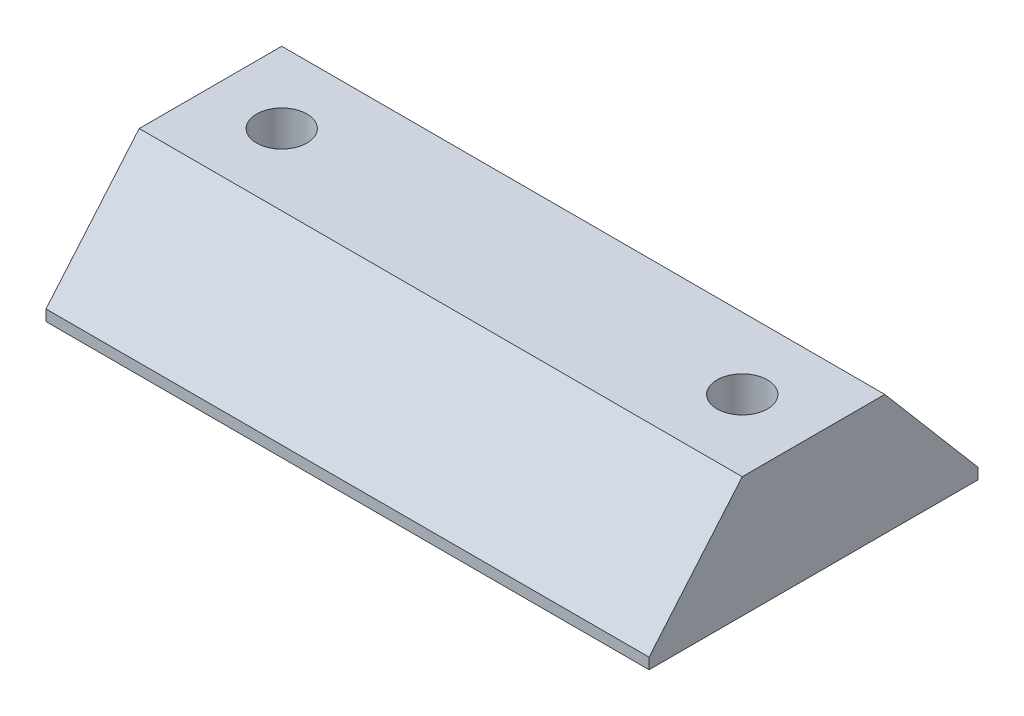
from build123d import *
from OCP.BRepFilletAPI import BRepFilletAPI_MakeChamfer

# Parameters (mm, degrees)
SKETCH2_W           = 55
SKETCH2_H           = 30
BOSS_EXTRUDE1_DEPTH = 11
CHAMFER1_SIZE       = 10
CHAMFER1_SIZE2      = 8.5
CUT_EXTRUDE1_REACH  = 65.608
SKETCH3_R           = 2.3
SKETCH4_W           = 22
SKETCH4_H           = 7.8
BOSS_EXTRUDE2_DEPTH = 3


with BuildPart() as part:
    # Sketch2 → Boss-Extrude1 (new body)
    with BuildSketch(Plane(origin=(0, 0, 0), x_dir=(1, 0, 0), z_dir=(0, 1, 0))):
        with Locations((27.5, 15)):
            Rectangle(SKETCH2_W, SKETCH2_H)
    extrude(amount=BOSS_EXTRUDE1_DEPTH)

    # Chamfer1: one chamfer whose edges measure the first distance from different faces: ONE call of the kernel's chamfer builder (chamfer() names one face for all edges)
    chamfer1_edges_1 = [part.edges().sort_by_distance(p)[0] for p in [
        (27.5, 11, -30),
    ]]
    chamfer1_side_1 = [part.faces().sort_by_distance(p)[0] for p in [
        (27.5, 5.5, -30),
    ]]
    chamfer1_edges_2 = [part.edges().sort_by_distance(p)[0] for p in [
        (27.5, 11, 0),
    ]]
    chamfer1_side_2 = [part.faces().sort_by_distance(p)[0] for p in [
        (27.5, 5.5, 0),
    ]]
    chamfer1 = BRepFilletAPI_MakeChamfer(part.part.solid().wrapped)
    for e in chamfer1_edges_1:
        chamfer1.Add(CHAMFER1_SIZE, CHAMFER1_SIZE2, e.wrapped, chamfer1_side_1[0].wrapped)  # the first distance lies on this face
    for e in chamfer1_edges_2:
        chamfer1.Add(CHAMFER1_SIZE, CHAMFER1_SIZE2, e.wrapped, chamfer1_side_2[0].wrapped)  # the first distance lies on this face
    add(Compound.cast(chamfer1.Shape()), mode=Mode.REPLACE)

    # Sketch3 → Cut-Extrude1 (cut, up to next)
    with BuildSketch(Plane(origin=(0, 11, 0), x_dir=(1, 0, 0), z_dir=(0, 1, 0)), mode=Mode.PRIVATE) as cut_extrude1_sk1:
        with Locations((6.5, 15)):
            Circle(SKETCH3_R)
    cut_extrude1_tool1 = extrude(cut_extrude1_sk1.sketch, amount=-CUT_EXTRUDE1_REACH, mode=Mode.PRIVATE) & part.part
    # Sketch3 → Cut-Extrude1 (cut, up to next)
    with BuildSketch(Plane(origin=(0, 11, 0), x_dir=(1, 0, 0), z_dir=(0, 1, 0)), mode=Mode.PRIVATE) as cut_extrude1_sk2:
        with Locations((48.5, 15)):
            Circle(SKETCH3_R)
    cut_extrude1_tool2 = extrude(cut_extrude1_sk2.sketch, amount=-CUT_EXTRUDE1_REACH, mode=Mode.PRIVATE) & part.part
    add(cut_extrude1_tool1.solids().sort_by_distance((6.5, 11, -15))[0], mode=Mode.SUBTRACT)
    add(cut_extrude1_tool2.solids().sort_by_distance((48.5, 11, -15))[0], mode=Mode.SUBTRACT)

    # Sketch4 → Boss-Extrude2 (add)
    with BuildSketch(Plane.XZ):
        with Locations((27.5, -14.9975)):
            Rectangle(SKETCH4_W, SKETCH4_H)
    extrude(amount=BOSS_EXTRUDE2_DEPTH)


solid = part.part
